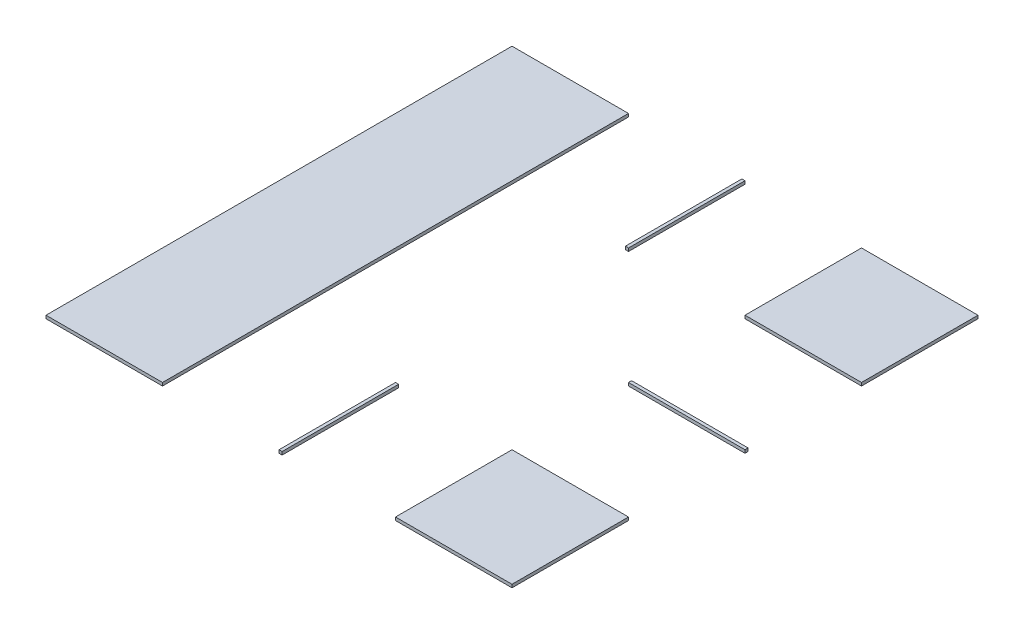
from build123d import *

# Parameters (mm, degrees)
SKETCH1_W             = 375
SKETCH1_H             = 1500
BOSS_EXTRUDE1_DEPTH   = 10
SKETCH1_H_2           = 375
BOSS_EXTRUDE1_2_DEPTH = 10
BOSS_EXTRUDE1_3_DEPTH = 10
SKETCH2_W             = 10
SKETCH2_H             = 375
EXTRUDE_THIN1_DEPTH   = 10
EXTRUDE_THIN1_2_DEPTH = 10
SKETCH2_W_2           = 375
SKETCH2_H_2           = 10
EXTRUDE_THIN1_3_DEPTH = 10


with BuildPart() as part:
    # Sketch1 → Boss-Extrude1 (new body)
    with BuildSketch(Plane(origin=(0, 0, 0), x_dir=(1, 0, 0), z_dir=(0, 1, 0))):
        with Locations((-562.5, 0)):
            Rectangle(SKETCH1_W, SKETCH1_H)
    extrude(amount=BOSS_EXTRUDE1_DEPTH)


with BuildPart() as body_2:
    # Sketch1 → Boss-Extrude1 2 (new body)
    with BuildSketch(Plane(origin=(0, 0, 0), x_dir=(1, 0, 0), z_dir=(0, 1, 0))):
        with Locations((562.5, -562.5)):
            Rectangle(SKETCH1_W, SKETCH1_H_2)
    extrude(amount=BOSS_EXTRUDE1_2_DEPTH)


with BuildPart() as body_3:
    # Sketch1 → Boss-Extrude1 3 (new body)
    with BuildSketch(Plane(origin=(0, 0, 0), x_dir=(1, 0, 0), z_dir=(0, 1, 0))):
        with Locations((562.5, 562.5)):
            Rectangle(SKETCH1_W, SKETCH1_H_2)
    extrude(amount=BOSS_EXTRUDE1_3_DEPTH)


with BuildPart() as body_4:
    # Sketch2 → Extrude-Thin1 (new body)
    with BuildSketch(Plane(origin=(0, 0, 0), x_dir=(1, 0, 0), z_dir=(0, 1, 0))):
        with Locations((-5, 562.5)):
            Rectangle(SKETCH2_W, SKETCH2_H)
    extrude(amount=EXTRUDE_THIN1_DEPTH)


with BuildPart() as body_5:
    # Sketch2 → Extrude-Thin1 2 (new body)
    with BuildSketch(Plane(origin=(0, 0, 0), x_dir=(1, 0, 0), z_dir=(0, 1, 0))):
        with Locations((5, -562.5)):
            Rectangle(SKETCH2_W, SKETCH2_H)
    extrude(amount=EXTRUDE_THIN1_2_DEPTH)


with BuildPart() as body_6:
    # Sketch2 → Extrude-Thin1 3 (new body)
    with BuildSketch(Plane(origin=(0, 0, 0), x_dir=(1, 0, 0), z_dir=(0, 1, 0))):
        with Locations((562.5, 5)):
            Rectangle(SKETCH2_W_2, SKETCH2_H_2)
    extrude(amount=EXTRUDE_THIN1_3_DEPTH)


solid = Compound([part.part, body_2.part, body_3.part, body_4.part, body_5.part, body_6.part])
